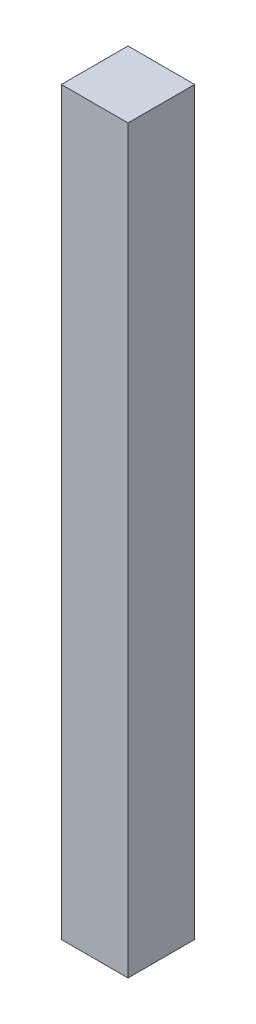
from build123d import *

# Parameters (mm, degrees)
SKETCH1_W           = 6.3
SKETCH1_H           = 6.3
BOSS_EXTRUDE1_DEPTH = 70


with BuildPart() as part:
    # Sketch1 → Boss-Extrude1 (new body)
    with BuildSketch(Plane(origin=(0, 0, 0), x_dir=(1, 0, 0), z_dir=(0, 1, 0))):
        Rectangle(SKETCH1_W, SKETCH1_H)
    extrude(amount=BOSS_EXTRUDE1_DEPTH)


solid = part.part
